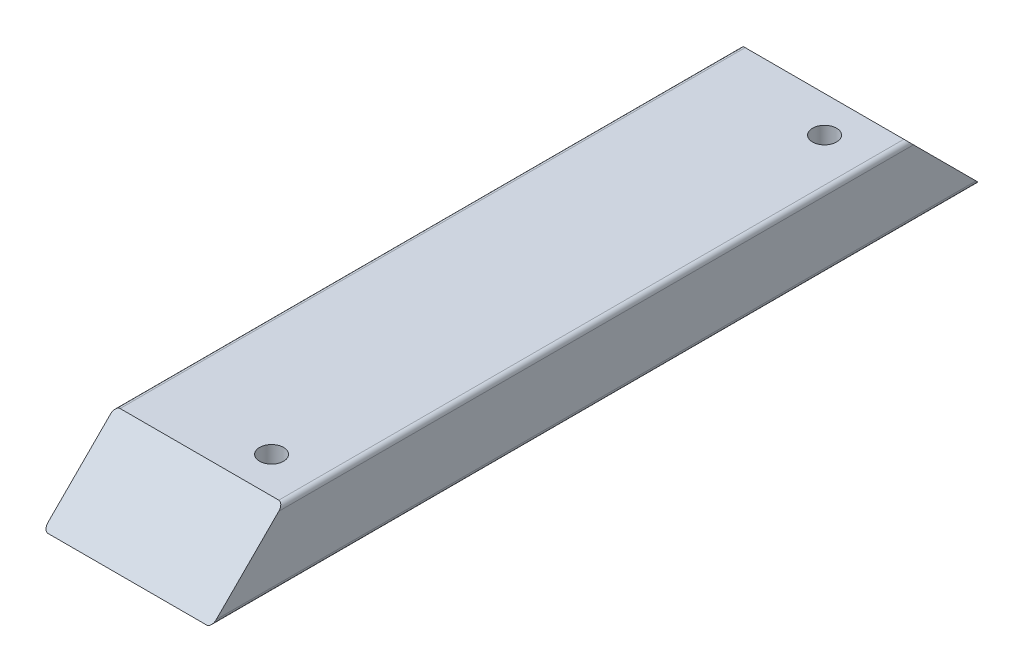
from build123d import *

# Parameters (mm, degrees)
SKETCH1_W           = 88.9
SKETCH1_H           = 38.1
BOSS_EXTRUDE1_DEPTH = 406.4
FILLET1_R           = 2.54
CUT_EXTRUDE1_DEPTH  = 406.4
SKETCH3_R           = 6.35
CUT_EXTRUDE2_DEPTH  = 406.4


with BuildPart() as part:
    # Sketch1 → Boss-Extrude1 (new body)
    with BuildSketch(Plane.XY):
        Rectangle(SKETCH1_W, SKETCH1_H)
    extrude(amount=BOSS_EXTRUDE1_DEPTH)

    # Fillet1
    fillet1_edges = [part.edges().sort_by_distance(p)[0] for p in [
        (-44.45, -19.05, 203.2),
        (44.45, -19.05, 203.2),
        (44.45, 19.05, 203.2),
        (-44.45, 19.05, 203.2),
    ]]
    fillet(fillet1_edges, radius=FILLET1_R)

    # Sketch2 → Cut-Extrude1 (cut)
    with BuildSketch(Plane.ZY.offset(44.45)):
        Polygon((0, 19.05), (0, -19.05), (38.1, 19.05), align=None)
    cut_extrude1 = extrude(amount=-CUT_EXTRUDE1_DEPTH, mode=Mode.SUBTRACT)

    # Mirror1: Cut-Extrude1 across plane
    add(cut_extrude1.mirror(Plane.XY.offset(203.2)), mode=Mode.SUBTRACT)

    # Sketch3 → Cut-Extrude2 (cut)
    with BuildSketch(Plane(origin=(0, 19.05, 0), x_dir=(1, 0, 0), z_dir=(0, 1, 0))):
        with Locations((19.05, -57.15)):
            Circle(SKETCH3_R)
    cut_extrude2 = extrude(amount=-CUT_EXTRUDE2_DEPTH, mode=Mode.SUBTRACT)

    # Mirror2: Cut-Extrude2 across plane
    add(cut_extrude2.mirror(Plane.XY.offset(203.2)), mode=Mode.SUBTRACT)


solid = part.part
